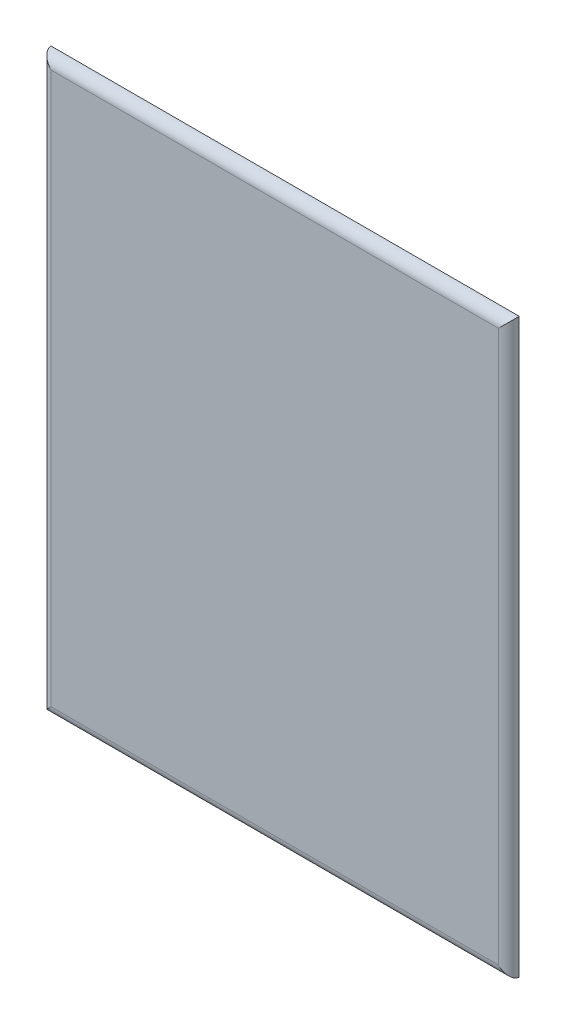
from build123d import *

# Parameters (mm, degrees)
ESQUISSE1_W        = 135
ESQUISSE1_H        = 165
BOSS_EXTRU_1_DEPTH = 3
CONG_1_R           = 3
BOSS_EXTRU_2_DEPTH = 5
CONG_2_R           = 2
ESQUISSE3_R        = 0.75
BOSS_EXTRU_3_DEPTH = 5


with BuildPart() as part:
    # Esquisse1 → Boss.-Extru.1 (new body)
    with BuildSketch(Plane.XY):
        Rectangle(ESQUISSE1_W, ESQUISSE1_H)
    extrude(amount=BOSS_EXTRU_1_DEPTH)

    # Congé1
    cong_1_edges = [part.edges().sort_by_distance(p)[0] for p in [
        (0, -82.5, 3),
        (0, 82.5, 3),
        (67.5, 0, 3),
        (-67.5, 0, 3),
    ]]
    fillet(cong_1_edges, radius=CONG_1_R - 0.0001)  # a hair under: the kernel refuses the full size

    # Esquisse2 → Boss.-Extru.2 (add)
    with BuildSketch(Plane(origin=(0, 0, 0), x_dir=(-1, 0, 0), z_dir=(0, 0, -1))):
        with BuildLine():
            Line((-14.5, -16.5), (14.5, -16.5))
            ThreePointArc((14.5, -16.5), (15.914213562, -15.914213562), (16.5, -14.5))
            Line((16.5, -14.5), (16.5, 14.5))
            ThreePointArc((16.5, 14.5), (15.914213562, 15.914213562), (14.5, 16.5))
            Line((14.5, 16.5), (-14.5, 16.5))
            ThreePointArc((-14.5, 16.5), (-15.914213562, 15.914213562), (-16.5, 14.5))
            Line((-16.5, 14.5), (-16.5, -14.5))
            ThreePointArc((-16.5, -14.5), (-15.914213562, -15.914213562), (-14.5, -16.5))
        make_face()
    extrude(amount=BOSS_EXTRU_2_DEPTH)

    # Congé2
    cong_2_edges = [part.edges().sort_by_distance(p)[0] for p in [
        (15.914213562, -15.914213562, -5),
        (0, -16.5, -5),
        (-15.914213562, -15.914213562, -5),
        (-16.5, 0, -5),
        (-15.914213562, 15.914213562, -5),
        (0, 16.5, -5),
        (15.914213562, 15.914213562, -5),
        (16.5, 0, -5),
    ]]
    fillet(cong_2_edges, radius=CONG_2_R)

    # Esquisse3 → Boss.-Extru.3 (add)
    with BuildSketch(Plane.ZY.offset(16.5)):
        with Locations(Location((-1.5, 0, 0), (0, 0, 180))):
            Circle(ESQUISSE3_R)
    extrude(amount=BOSS_EXTRU_3_DEPTH)


solid = part.part
